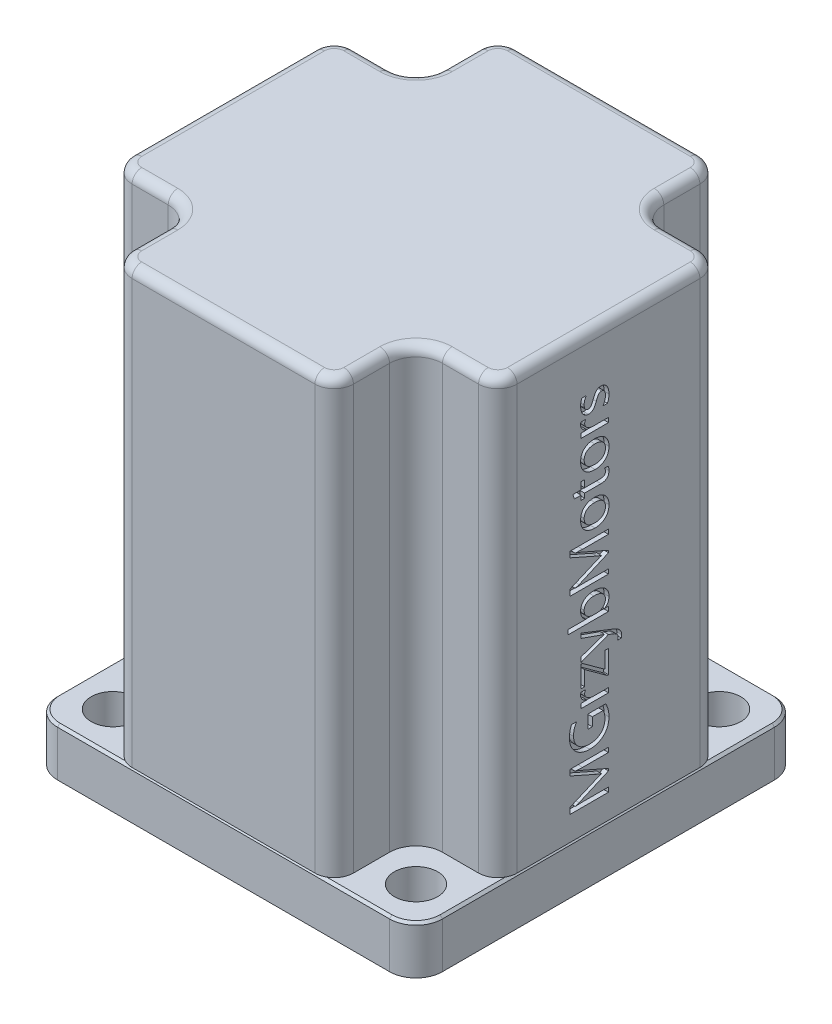
from build123d import *

# Parameters (mm, degrees)
SKETCH1_W                                  = 40
SKETCH1_H                                  = 40
BOSS_EXTRUDE1_DEPTH                        = 5
BOSS_EXTRUDE3_DEPTH                        = 45
SKETCH3_4_R                                = 2.25
CUT_EXTRUDE1_DEPTH                         = 5
MIRROR4_AT_THE_SECOND_PLANE_COPY_1_SKETC_R = 2.25
MIRROR4_AT_THE_SECOND_PLANE_COPY_1_DEPTH   = 5
FILLET3_R                                  = 2.75
FILLET1_R                                  = 2.75
FILLET2_R                                  = 2
MIRROR1_START                              = 5
MIRROR1_DEPTH                              = 45
MIRROR1_2_DEPTH                            = 45
MIRROR1_3_DEPTH                            = 45
FILLET4_R                                  = 1
SKETCH4_R                                  = 5
BOSS_EXTRUDE4_DEPTH                        = 15
CHAMFER1_SIZE                              = 0.75
CHAMFER2_SIZE                              = 0.25
CUT_EXTRUDE3_DEPTH                         = 0.5


# Read off the part's stored shape, not the designer's step: Mirror1
with BuildPart() as part:
    # Sketch1 → Boss-Extrude1 (new body)
    with BuildSketch(Plane(origin=(0, 0, 0), x_dir=(-1, 0, 0), z_dir=(0, 1, 0))):
        Rectangle(SKETCH1_W, SKETCH1_H)
    extrude(amount=BOSS_EXTRUDE1_DEPTH)

    # Sketch3<4> → Cut-Extrude1 (cut)
    with BuildSketch(Plane(origin=(0, 5, 0), x_dir=(-1, 0, 0), z_dir=(0, 1, 0))):
        with Locations(Location((-15.75, 15.75, 0), (0, 0, 90))):
            Circle(SKETCH3_4_R)
    cut_extrude1 = extrude(amount=-CUT_EXTRUDE1_DEPTH, mode=Mode.SUBTRACT)

    # Mirror4: Cut-Extrude1 across plane
    add(cut_extrude1.mirror(Plane.XY), mode=Mode.SUBTRACT)

    # Mirror4 at the second plane: Cut-Extrude1 across plane
    add(cut_extrude1.mirror(Plane(origin=(0, 0, 0), x_dir=(0, 0, 1), z_dir=(1, 0, 0))), mode=Mode.SUBTRACT)

    # Mirror4 at the second plane copy 1 sketc → Mirror4 at the second plane copy 1 (cut)
    with BuildSketch(Plane(origin=(0, 5, 0), x_dir=(1, 0, 0), z_dir=(0, 1, 0))):
        with Locations(Location((-15.75, 15.75, 0), (0, 0, 90))):
            Circle(MIRROR4_AT_THE_SECOND_PLANE_COPY_1_SKETC_R)
    extrude(amount=-MIRROR4_AT_THE_SECOND_PLANE_COPY_1_DEPTH, mode=Mode.SUBTRACT)

    # Fillet3
    fillet3_edges = [part.edges().sort_by_distance(p)[0] for p in [
        (20, 2.5, 20),
        (20, 2.5, -20),
        (-20, 2.5, -20),
        (-20, 2.5, 20),
    ]]
    fillet(fillet3_edges, radius=FILLET3_R)

    # Chamfer2
    chamfer2_edges = [part.edges().sort_by_distance(p)[0] for p in [
        (0, 5, -20),
        (20, 5, 0),
        (-20, 5, 0),
        (0, 5, 20),
        (19.194543648, 5, 19.194543648),
        (-19.194543648, 5, 19.194543648),
        (-19.194543648, 5, -19.194543648),
        (19.194543648, 5, -19.194543648),
    ]]
    chamfer(chamfer2_edges, length=CHAMFER2_SIZE)


with BuildPart() as body_2:
    # Sketch3 → Boss-Extrude3 (new body)
    with BuildSketch(Plane(origin=(0, 5, 0), x_dir=(-1, 0, 0), z_dir=(0, 1, 0))):
        Polygon((-11.5, 20), (-11.5, 11.5), (-20, 11.5), (-20, 0), (0, 0), (0, 20), align=None)
    extrude(amount=BOSS_EXTRUDE3_DEPTH)

    # Fillet1
    fillet1_edges = [body_2.edges().sort_by_distance(p)[0] for p in [
        (11.5, 27.5, 11.5),
    ]]
    fillet(fillet1_edges, radius=FILLET1_R)

    # Fillet2
    fillet2_edges = [body_2.edges().sort_by_distance(p)[0] for p in [
        (20, 27.5, 11.5),
        (11.5, 27.5, 20),
    ]]
    fillet(fillet2_edges, radius=FILLET2_R)


with BuildPart() as body_3:
    # Mirror1 outline → Mirror1 (new body)
    with BuildSketch(Plane(origin=(0, 0, 0), x_dir=(1, 0, 0), z_dir=(0, 1, 0)).offset(MIRROR1_START)):
        with BuildLine():
            ThreePointArc((-18, 11.5), (-19.414213562, 10.914213562), (-20, 9.5))
            Line((-20, 9.5), (-20, 0))
            Line((-20, 0), (0, 0))
            Line((0, 0), (0, 20))
            Line((0, 20), (-9.5, 20))
            ThreePointArc((-9.5, 20), (-10.914213562, 19.414213562), (-11.5, 18))
            Line((-11.5, 18), (-11.5, 14.25))
            ThreePointArc((-11.5, 14.25), (-12.305456352, 12.305456352), (-14.25, 11.5))
            Line((-14.25, 11.5), (-18, 11.5))
        make_face()
    extrude(amount=MIRROR1_DEPTH)


with BuildPart() as body_4:
    # Mirror1 2 outline → Mirror1 2 (new body)
    with BuildSketch(Plane(origin=(0, 0, 0), x_dir=(1, 0, 0), z_dir=(0, 1, 0)).offset(MIRROR1_START)):
        with BuildLine():
            Line((0, 0), (-20, 0))
            Line((-20, 0), (-20, -9.5))
            ThreePointArc((-20, -9.5), (-19.414213562, -10.914213562), (-18, -11.5))
            Line((-18, -11.5), (-14.25, -11.5))
            ThreePointArc((-14.25, -11.5), (-12.305456352, -12.305456352), (-11.5, -14.25))
            Line((-11.5, -14.25), (-11.5, -18))
            ThreePointArc((-11.5, -18), (-10.914213562, -19.414213562), (-9.5, -20))
            Line((-9.5, -20), (0, -20))
            Line((0, -20), (0, 0))
        make_face()
    extrude(amount=MIRROR1_2_DEPTH)


with BuildPart() as body_5:
    # Mirror1 3 outline → Mirror1 3 (new body)
    with BuildSketch(Plane(origin=(0, 0, 0), x_dir=(1, 0, 0), z_dir=(0, 1, 0)).offset(MIRROR1_START)):
        with BuildLine():
            Line((0, 0), (20, 0))
            Line((20, 0), (20, 9.5))
            ThreePointArc((20, 9.5), (19.414213562, 10.914213562), (18, 11.5))
            Line((18, 11.5), (14.25, 11.5))
            ThreePointArc((14.25, 11.5), (12.305456352, 12.305456352), (11.5, 14.25))
            Line((11.5, 14.25), (11.5, 18))
            ThreePointArc((11.5, 18), (10.914213562, 19.414213562), (9.5, 20))
            Line((9.5, 20), (0, 20))
            Line((0, 20), (0, 0))
        make_face()
    extrude(amount=MIRROR1_3_DEPTH)


with BuildPart() as body_2_1:
    add(body_2.part)

    # Combine1: union body 5, body 4, body 3
    add(body_5.part)
    add(body_4.part)
    add(body_3.part)

    # Fillet4
    fillet4_edges = [body_2_1.edges().sort_by_distance(p)[0] for p in [
        (16.125, 50, 11.5),
        (20, 50, 0),
        (12.305456352, 50, 12.305456352),
        (0, 50, 20),
        (11.5, 50, 16.125),
        (10.914213562, 50, 19.414213562),
        (19.414213562, 50, 10.914213562),
        (0, 50, -20),
        (-10.914213562, 50, -19.414213562),
        (-11.5, 50, -16.125),
        (-12.305456352, 50, -12.305456352),
        (-16.125, 50, -11.5),
        (-19.414213562, 50, -10.914213562),
        (-20, 50, 0),
        (16.125, 50, -11.5),
        (11.5, 50, -16.125),
        (12.305456352, 50, -12.305456352),
        (19.414213562, 50, -10.914213562),
        (10.914213562, 50, -19.414213562),
        (-16.125, 50, 11.5),
        (-11.5, 50, 16.125),
        (-12.305456352, 50, 12.305456352),
        (-19.414213562, 50, 10.914213562),
        (-10.914213562, 50, 19.414213562),
    ]]
    fillet(fillet4_edges, radius=FILLET4_R)

    # Sketch7 → Cut-Extrude3 (cut)
    # profile 1 of 12: a face of its own
    with BuildSketch(Plane.YZ.offset(20)):
        with BuildLine():
            Line((11.578947368, 0), (11.105263158, 0))
            Line((11.105263158, 0), (11.105263158, 2.683388158))
            add(Edge.make_bspline(
                [(11.105263158, 2.683388158), (11.105789439, 2.739316175), (11.106899155, 2.857246069), (11.114868306, 3.042863813), (11.127145573, 3.246300748), (11.138706481, 3.387629341), (11.144736842, 3.461348684)],
                knots=[0, 0, 0, 0, 0.861329844, 1.816201289, 2.860894294, 4, 4, 4, 4], degree=3))
            Line((11.144736842, 3.461348684), (11.134046053, 3.461348684))
            add(Edge.make_bspline(
                [(11.134046053, 3.461348684), (11.123633642, 3.419332442), (11.104371156, 3.341604303), (11.073796767, 3.235241686), (11.045939322, 3.147612473), (11.024953149, 3.096660717), (11.015625, 3.074013158)],
                knots=[0, 0, 0, 0, 1.280964309, 2.369725788, 3.275358994, 4, 4, 4, 4], degree=3))
            Line((11.015625, 3.074013158), (9.671875, 0))
            Line((9.671875, 0), (9.447368421, 0))
            Line((9.447368421, 0), (8.106085526, 3.050986842))
            add(Edge.make_bspline(
                [(8.106085526, 3.050986842), (8.096198201, 3.076101014), (8.074302456, 3.131717016), (8.045368844, 3.225772071), (8.016149819, 3.337579809), (7.997582135, 3.418256426), (7.987664474, 3.461348684)],
                knots=[0, 0, 0, 0, 0.757222991, 1.676890445, 2.759144333, 4, 4, 4, 4], degree=3))
            Line((7.987664474, 3.461348684), (7.976973684, 3.461348684))
            add(Edge.make_bspline(
                [(7.976973684, 3.461348684), (7.979066365, 3.439705574), (7.98353747, 3.393464111), (7.986888214, 3.319077655), (7.991390672, 3.235503488), (7.994475171, 3.142283564), (7.997014782, 3.039484478), (7.998257116, 2.927082372), (8.000488668, 2.80537998), (8.00016673, 2.721218289), (8, 2.677631579)],
                knots=[0, 0, 0, 0, 0.665274613, 1.421388671, 2.278025934, 3.226501166, 4.275344644, 5.424668624, 6.666255159, 8, 8, 8, 8], degree=3))
            Line((8, 2.677631579), (8, 0))
            Line((8, 0), (7.526315789, 0))
            Line((7.526315789, 0), (7.526315789, 4))
            Line((7.526315789, 4), (8.166940789, 4))
            Line((8.166940789, 4), (9.370888158, 1.210526316))
            add(Edge.make_bspline(
                [(9.370888158, 1.210526316), (9.392647549, 1.160514265), (9.432972318, 1.067831321), (9.483377708, 0.937427688), (9.524626296, 0.82844843), (9.54343154, 0.761092402), (9.551809211, 0.731085526)],
                knots=[0, 0, 0, 0, 1.275894141, 2.364502614, 3.271391623, 4, 4, 4, 4], degree=3))
            Line((9.551809211, 0.731085526), (9.568256579, 0.731085526))
            add(Edge.make_bspline(
                [(9.568256579, 0.731085526), (9.586766258, 0.782394977), (9.621378569, 0.878341459), (9.671602543, 1.0115504), (9.715372667, 1.124226995), (9.744355626, 1.191678488), (9.757401316, 1.222039474)],
                knots=[0, 0, 0, 0, 1.243852458, 2.325950982, 3.246484013, 4, 4, 4, 4], degree=3))
            Line((9.757401316, 1.222039474), (10.986019737, 4))
            Line((10.986019737, 4), (11.578947368, 4))
            Line((11.578947368, 4), (11.578947368, 0))
        make_face()
    # profile 2 of 12: a face of its own
    with BuildSketch(Plane.YZ.offset(20)):
        with BuildLine():
            add(Edge.make_bspline(
                [(15.631578947, 0.287828947), (15.580966796, 0.260480149), (15.479791398, 0.205808979), (15.321595006, 0.137580356), (15.159759694, 0.078399616), (14.993547356, 0.031406281), (14.823543277, -0.007419389), (14.648882288, -0.032697885), (14.470209469, -0.050348524), (14.34955108, -0.051865777), (14.288651316, -0.052631579)],
                knots=[0, 0, 0, 0, 0.985173486, 1.969395032, 2.948415053, 3.935411455, 4.926689083, 5.933596423, 6.95702659, 8, 8, 8, 8], degree=3))
            add(Edge.make_bspline(
                [(14.288651316, -0.052631579), (14.218655758, -0.051290779), (14.081706281, -0.048667442), (13.88167326, -0.021126974), (13.691496409, 0.021037128), (13.511368371, 0.081103677), (13.342013524, 0.158915654), (13.182482872, 0.253108468), (13.034304567, 0.365959085), (12.896381014, 0.493618189), (12.772267528, 0.63581838), (12.663855552, 0.790442805), (12.572461029, 0.95657201), (12.497072938, 1.133325977), (12.439876865, 1.321539075), (12.397812548, 1.520110119), (12.372916633, 1.730177392), (12.369943077, 1.873836203), (12.368421053, 1.947368421)],
                knots=[0, 0, 0, 0, 1.075463732, 2.104193497, 3.09793841, 4.066788811, 5.017206145, 5.958224378, 6.908968671, 7.875129841, 8.842852226, 9.805053137, 10.772702109, 11.752706894, 12.753796791, 13.791927036, 14.869790854, 16, 16, 16, 16], degree=3))
            add(Edge.make_bspline(
                [(12.368421053, 1.947368421), (12.370110326, 2.022558781), (12.373426342, 2.170156229), (12.400912013, 2.386358595), (12.446873802, 2.59206794), (12.511324705, 2.787388735), (12.593646288, 2.972467392), (12.694850681, 3.146986533), (12.813629504, 3.311666716), (12.950877696, 3.463542528), (13.100965307, 3.601793417), (13.262255237, 3.723249218), (13.434229115, 3.824399883), (13.61542312, 3.90807115), (13.806329806, 3.973478644), (14.007330843, 4.018932596), (14.217902513, 4.047942103), (14.361744677, 4.051048736), (14.435032895, 4.052631579)],
                knots=[0, 0, 0, 0, 1.091168556, 2.141946043, 3.157505749, 4.146549577, 5.122669649, 6.092516332, 7.069941329, 8.064612366, 9.058742024, 10.028066134, 10.989616371, 11.949262799, 12.920716264, 13.912996644, 14.93666257, 16, 16, 16, 16], degree=3))
            add(Edge.make_bspline(
                [(14.435032895, 4.052631579), (14.488225362, 4.052004168), (14.592238403, 4.050777322), (14.745171409, 4.041048431), (14.891320799, 4.023338797), (15.031565795, 4.001131769), (15.164775524, 3.970125065), (15.291958001, 3.934473349), (15.412390488, 3.89106722), (15.488709694, 3.85606369), (15.526315789, 3.838815789)],
                knots=[0, 0, 0, 0, 1.138495796, 2.226225164, 3.277845496, 4.2887232, 5.263699823, 6.203418853, 7.1147392, 8, 8, 8, 8], degree=3))
            Line((15.526315789, 3.838815789), (15.526315789, 3.315789474))
            add(Edge.make_bspline(
                [(15.526315789, 3.315789474), (15.485318772, 3.341159398), (15.403227339, 3.39195952), (15.272530679, 3.455756637), (15.136716688, 3.510084861), (14.995195257, 3.554817191), (14.848060197, 3.589094466), (14.695562235, 3.613624362), (14.537592755, 3.628892809), (14.430407883, 3.630672575), (14.375822368, 3.631578947)],
                knots=[0, 0, 0, 0, 0.955856486, 1.91398384, 2.880300269, 3.855389111, 4.85515173, 5.874246543, 6.917427944, 8, 8, 8, 8], degree=3))
            add(Edge.make_bspline(
                [(14.375822368, 3.631578947), (14.320929068, 3.630138137), (14.213182677, 3.627310065), (14.055269328, 3.605620246), (13.905102488, 3.569532319), (13.762624647, 3.519032756), (13.627568037, 3.454684406), (13.500229399, 3.375113315), (13.38067198, 3.280973935), (13.270095348, 3.173091278), (13.169208118, 3.054855517), (13.081751472, 2.926418397), (13.006927616, 2.790091866), (12.947165671, 2.644515591), (12.900107577, 2.490882338), (12.866673003, 2.32873681), (12.845464083, 2.15818408), (12.843239924, 2.041456706), (12.842105263, 1.981907895)],
                knots=[0, 0, 0, 0, 1.041948336, 2.045170763, 3.01967306, 3.96947189, 4.909927833, 5.854393042, 6.8143471, 7.793369543, 8.782959064, 9.760250794, 10.738429031, 11.730082949, 12.742550622, 13.784706906, 14.869861746, 16, 16, 16, 16], degree=3))
            add(Edge.make_bspline(
                [(12.842105263, 1.981907895), (12.843344193, 1.920723795), (12.845756049, 1.8016151), (12.865168386, 1.628136407), (12.895667113, 1.464467209), (12.940689287, 1.311168261), (12.995905666, 1.166628836), (13.066487711, 1.033467584), (13.148145881, 0.909445795), (13.243012114, 0.797102081), (13.347890699, 0.695680273), (13.463206379, 0.608016109), (13.586935477, 0.533625449), (13.719968135, 0.473125546), (13.861794428, 0.426486628), (14.012709225, 0.392854922), (14.172375442, 0.371787077), (14.282005607, 0.369558951), (14.337993421, 0.368421053)],
                knots=[0, 0, 0, 0, 1.179150513, 2.295483288, 3.360863653, 4.384322083, 5.371505408, 6.338238235, 7.283546942, 8.228737486, 9.166796092, 10.090516322, 11.014886255, 11.944212146, 12.90171567, 13.887554493, 14.92118009, 16, 16, 16, 16], degree=3))
            add(Edge.make_bspline(
                [(14.337993421, 0.368421053), (14.376930487, 0.369177826), (14.453245238, 0.370661064), (14.565877393, 0.378642266), (14.674326665, 0.393499563), (14.778828152, 0.414270492), (14.879880111, 0.439394756), (14.976529104, 0.471519778), (15.069471146, 0.50935006), (15.128483339, 0.539332973), (15.157894737, 0.554276316)],
                knots=[0, 0, 0, 0, 1.10055124, 2.157026801, 3.189133023, 4.191920593, 5.167125343, 6.129942106, 7.067971983, 8, 8, 8, 8], degree=3))
            Line((15.157894737, 0.554276316), (15.157894737, 1.684210526))
            Line((15.157894737, 1.684210526), (14.263157895, 1.684210526))
            Line((14.263157895, 1.684210526), (14.263157895, 2.105263158))
            Line((14.263157895, 2.105263158), (15.631578947, 2.105263158))
            Line((15.631578947, 2.105263158), (15.631578947, 0.287828947))
        make_face()
    # profile 3 of 12: a face of its own
    with BuildSketch(Plane.YZ.offset(20)):
        with BuildLine():
            add(Edge.make_bspline(
                [(17.947368421, 2.368421053), (17.926632713, 2.384831984), (17.883836246, 2.418702537), (17.803783798, 2.450572979), (17.71208595, 2.470564381), (17.646507471, 2.472605341), (17.611842105, 2.473684211)],
                knots=[0, 0, 0, 0, 0.878870937, 1.813903376, 2.84440993, 4, 4, 4, 4], degree=3))
            add(Edge.make_bspline(
                [(17.611842105, 2.473684211), (17.588747005, 2.472989112), (17.54299142, 2.471611997), (17.475879689, 2.45767846), (17.41144772, 2.43641535), (17.349828402, 2.406592274), (17.291786172, 2.367167185), (17.236682073, 2.319314637), (17.184842522, 2.262652748), (17.135521885, 2.198948604), (17.091240961, 2.127262247), (17.052617207, 2.048727235), (17.019624248, 1.964042945), (16.993773306, 1.872726325), (16.972086156, 1.775915403), (16.957454615, 1.672532628), (16.949577247, 1.562898463), (16.948118308, 1.487676741), (16.947368421, 1.449013158)],
                knots=[0, 0, 0, 0, 0.815860524, 1.616367774, 2.413521298, 3.211382041, 4.028854029, 4.888038505, 5.786792903, 6.740897554, 7.733677144, 8.761304915, 9.832598907, 10.943311596, 12.114819035, 13.339252953, 14.632389512, 16, 16, 16, 16], degree=3))
            Line((16.947368421, 1.449013158), (16.947368421, 0))
            Line((16.947368421, 0), (16.473684211, 0))
            Line((16.473684211, 0), (16.473684211, 2.842105263))
            Line((16.473684211, 2.842105263), (16.947368421, 2.842105263))
            Line((16.947368421, 2.842105263), (16.947368421, 2.257401316))
            Line((16.947368421, 2.257401316), (16.958059211, 2.257401316))
            add(Edge.make_bspline(
                [(16.958059211, 2.257401316), (16.974698359, 2.305301063), (17.006882267, 2.3979501), (17.073033601, 2.525112864), (17.152699968, 2.634797348), (17.243381922, 2.727669924), (17.343375571, 2.802152831), (17.451033179, 2.85584091), (17.564990491, 2.888560775), (17.643156228, 2.892666712), (17.682565789, 2.894736842)],
                knots=[0, 0, 0, 0, 1.175184694, 2.273075233, 3.310967915, 4.30922164, 5.273268503, 6.188979233, 7.086920469, 8, 8, 8, 8], degree=3))
            add(Edge.make_bspline(
                [(17.682565789, 2.894736842), (17.709721189, 2.894300901), (17.760856766, 2.893479992), (17.832491966, 2.886546399), (17.894089887, 2.873833505), (17.930489886, 2.860584364), (17.947368421, 2.854440789)],
                knots=[0, 0, 0, 0, 1.209052282, 2.276732743, 3.200927857, 4, 4, 4, 4], degree=3))
            Line((17.947368421, 2.854440789), (17.947368421, 2.368421053))
        make_face()
    # profile 4 of 12: a face of its own
    with BuildSketch(Plane.YZ.offset(20)):
        Polygon((20.473684211, 2.71875), (18.778782895, 0.368421053), (20.473684211, 0.368421053), (20.473684211, 0), (18.105263158, 0), (18.105263158, 0.134046053), (19.800164474, 2.473684211), (18.263157895, 2.473684211), (18.263157895, 2.842105263), (20.473684211, 2.842105263), align=None)
    # profile 5 of 12: a face of its own
    with BuildSketch(Plane.YZ.offset(20)):
        with BuildLine():
            Line((23.263157895, 2.842105263), (21.981085526, -0.460526316))
            add(Edge.make_bspline(
                [(21.981085526, -0.460526316), (21.966916605, -0.49740712), (21.939279818, -0.569343928), (21.892892921, -0.67199935), (21.845309057, -0.76798165), (21.795244072, -0.856586852), (21.743314538, -0.938545404), (21.68928232, -1.013543652), (21.632482431, -1.081005251), (21.573760688, -1.141569208), (21.513014821, -1.19532714), (21.449590374, -1.241447781), (21.384030681, -1.2804483), (21.316700374, -1.312722068), (21.246888244, -1.33746395), (21.175111706, -1.355750635), (21.100943465, -1.366713358), (21.05074883, -1.367849436), (21.025493421, -1.368421053)],
                knots=[0, 0, 0, 0, 1.346777045, 2.626917816, 3.839029768, 4.998283461, 6.095005847, 7.145640523, 8.147242649, 9.098984388, 10.01951448, 10.909358, 11.768486433, 12.6171295, 13.450766775, 14.28947053, 15.139347838, 16, 16, 16, 16], degree=3))
            add(Edge.make_bspline(
                [(21.025493421, -1.368421053), (20.997790438, -1.367937084), (20.944768995, -1.367010804), (20.868975694, -1.360347858), (20.800125455, -1.350208952), (20.757327271, -1.339166839), (20.736842105, -1.333881579)],
                knots=[0, 0, 0, 0, 1.140028558, 2.18192956, 3.129788448, 4, 4, 4, 4], degree=3))
            Line((20.736842105, -1.333881579), (20.736842105, -0.947368421))
            add(Edge.make_bspline(
                [(20.736842105, -0.947368421), (20.760021518, -0.955450135), (20.805062193, -0.971153977), (20.872272468, -0.987230962), (20.936331431, -0.998003761), (20.978030014, -0.999345831), (20.998355263, -1)],
                knots=[0, 0, 0, 0, 1.098295191, 2.134133314, 3.090515715, 4, 4, 4, 4], degree=3))
            add(Edge.make_bspline(
                [(20.998355263, -1), (21.025368939, -0.998873095), (21.078574903, -0.996653551), (21.155357603, -0.974831535), (21.227400103, -0.941140635), (21.29264345, -0.891912317), (21.353913188, -0.830959333), (21.408440733, -0.755324371), (21.458019178, -0.666580863), (21.485049466, -0.601467567), (21.499177632, -0.567434211)],
                knots=[0, 0, 0, 0, 0.914459721, 1.801113994, 2.68718276, 3.598658145, 4.558797161, 5.609770523, 6.750677093, 8, 8, 8, 8], degree=3))
            Line((21.499177632, -0.567434211), (21.720394737, 0))
            Line((21.720394737, 0), (20.631578947, 2.842105263))
            Line((20.631578947, 2.842105263), (21.137335526, 2.842105263))
            Line((21.137335526, 2.842105263), (21.882401316, 0.649671053))
            add(Edge.make_bspline(
                [(21.882401316, 0.649671053), (21.885140617, 0.639802288), (21.892059558, 0.614875715), (21.904860998, 0.56901311), (21.919668318, 0.506231719), (21.931663714, 0.458861204), (21.938322368, 0.432565789)],
                knots=[0, 0, 0, 0, 0.548175527, 1.384584366, 2.548180464, 4, 4, 4, 4], degree=3))
            Line((21.938322368, 0.432565789), (21.954769737, 0.432565789))
            add(Edge.make_bspline(
                [(21.954769737, 0.432565789), (21.957478452, 0.445182193), (21.963676364, 0.474050248), (21.974902435, 0.522180267), (21.991208817, 0.579702427), (22.002262617, 0.621418127), (22.008223684, 0.643914474)],
                knots=[0, 0, 0, 0, 0.710167537, 1.62496037, 2.719194077, 4, 4, 4, 4], degree=3))
            Line((22.008223684, 0.643914474), (22.791118421, 2.842105263))
            Line((22.791118421, 2.842105263), (23.263157895, 2.842105263))
        make_face()
    # profile 6 of 12: a face of its own
    with BuildSketch(Plane.YZ.offset(20)):
        with BuildLine():
            Line((24.273848684, 0.410361842), (24.263157895, 0.410361842))
            Line((24.263157895, 0.410361842), (24.263157895, 0))
            Line((24.263157895, 0), (23.789473684, 0))
            Line((23.789473684, 0), (23.789473684, 4.210526316))
            Line((23.789473684, 4.210526316), (24.263157895, 4.210526316))
            Line((24.263157895, 4.210526316), (24.263157895, 2.34375))
            Line((24.263157895, 2.34375), (24.273848684, 2.34375))
            add(Edge.make_bspline(
                [(24.273848684, 2.34375), (24.302388549, 2.387566834), (24.358092331, 2.47308803), (24.457922895, 2.585761484), (24.567327851, 2.681063705), (24.685621737, 2.760493134), (24.814718637, 2.82093915), (24.953451076, 2.863340486), (25.101443718, 2.890761989), (25.203548338, 2.893392041), (25.255756579, 2.894736842)],
                knots=[0, 0, 0, 0, 1.06086026, 2.070574921, 3.045194812, 4.000949981, 4.954757542, 5.928486642, 6.940791637, 8, 8, 8, 8], degree=3))
            add(Edge.make_bspline(
                [(25.255756579, 2.894736842), (25.300233814, 2.89378259), (25.386838315, 2.891924504), (25.512997417, 2.873063119), (25.631828895, 2.843716845), (25.743720869, 2.802901398), (25.847338032, 2.748438098), (25.944086107, 2.683632595), (26.032871987, 2.605896439), (26.114058083, 2.51742663), (26.185850713, 2.418387704), (26.250081535, 2.312154259), (26.302298598, 2.196702753), (26.346275122, 2.073869537), (26.379463383, 1.942414005), (26.404495711, 1.803170144), (26.41806467, 1.655698277), (26.420041794, 1.554849912), (26.421052632, 1.503289474)],
                knots=[0, 0, 0, 0, 1.040920675, 2.02684396, 2.979693932, 3.903848967, 4.808284923, 5.714541588, 6.624609883, 7.565119002, 8.520387817, 9.484801456, 10.46714454, 11.482351088, 12.536431192, 13.638278224, 14.792529641, 16, 16, 16, 16], degree=3))
            add(Edge.make_bspline(
                [(26.421052632, 1.503289474), (26.419835878, 1.445967268), (26.417455971, 1.333848065), (26.402146819, 1.169921377), (26.374911782, 1.014900414), (26.337437229, 0.868310003), (26.287703831, 0.730987207), (26.228880686, 0.601550467), (26.157363518, 0.481827209), (26.076559055, 0.371027411), (25.986126882, 0.271196409), (25.887220864, 0.184287058), (25.779649749, 0.111130888), (25.66445998, 0.050744601), (25.540694409, 0.005003089), (25.409729704, -0.029334296), (25.270332144, -0.048957435), (25.174676294, -0.051389474), (25.125822368, -0.052631579)],
                knots=[0, 0, 0, 0, 1.205136271, 2.357182818, 3.457185859, 4.511116471, 5.533763717, 6.523921933, 7.495474036, 8.460251117, 9.402651037, 10.321569335, 11.221497407, 12.131408265, 13.048734923, 13.989441718, 14.973155681, 16, 16, 16, 16], degree=3))
            add(Edge.make_bspline(
                [(25.125822368, -0.052631579), (25.080232295, -0.051210928), (24.991271261, -0.048438777), (24.862191534, -0.026834385), (24.74169124, 0.009129507), (24.63035124, 0.061182279), (24.52654467, 0.126092821), (24.432490372, 0.206985628), (24.346410451, 0.301535315), (24.298433434, 0.37349018), (24.273848684, 0.410361842)],
                knots=[0, 0, 0, 0, 1.075804616, 2.099244091, 3.079824819, 4.035292939, 4.992206317, 5.960841921, 6.955079002, 8, 8, 8, 8], degree=3))
        make_face()
        with BuildLine():
            Line((24.263157895, 1.556743421), (24.263157895, 1.160361842))
            add(Edge.make_bspline(
                [(24.263157895, 1.160361842), (24.263713189, 1.131546296), (24.26480664, 1.074804538), (24.275747497, 0.991348805), (24.294006303, 0.911351895), (24.318536207, 0.834357053), (24.350788547, 0.760773579), (24.390591961, 0.690794952), (24.436819462, 0.6236993), (24.489872618, 0.560786678), (24.548778862, 0.503792441), (24.611300631, 0.452863387), (24.678453538, 0.411018982), (24.748874056, 0.376073557), (24.823227885, 0.348623154), (24.901957376, 0.330059345), (24.984292083, 0.318228446), (25.040529217, 0.316610733), (25.069078947, 0.315789474)],
                knots=[0, 0, 0, 0, 1.060559599, 2.088387144, 3.092297372, 4.078599161, 5.059359448, 6.04462781, 7.038543559, 8.055610302, 9.069165237, 10.052777859, 11.018886615, 11.975830704, 12.943361951, 13.929921928, 14.949089947, 16, 16, 16, 16], degree=3))
            add(Edge.make_bspline(
                [(25.069078947, 0.315789474), (25.102578545, 0.316688861), (25.168001519, 0.318445319), (25.26321339, 0.333562697), (25.352903953, 0.358326817), (25.437086326, 0.392697813), (25.515606143, 0.43781435), (25.587828018, 0.493300717), (25.655149324, 0.55789592), (25.715805075, 0.632532827), (25.770986601, 0.715100199), (25.817778145, 0.80675025), (25.858127382, 0.905458581), (25.890849813, 1.012007508), (25.916428816, 1.126112098), (25.933806992, 1.247941852), (25.946113868, 1.37749066), (25.946942221, 1.466525699), (25.947368421, 1.512335526)],
                knots=[0, 0, 0, 0, 0.960642842, 1.876085531, 2.757624475, 3.625159744, 4.477736387, 5.347585705, 6.231961721, 7.148316088, 8.101525753, 9.07588157, 10.095282687, 11.157471837, 12.269835561, 13.44658822, 14.686232383, 16, 16, 16, 16], degree=3))
            add(Edge.make_bspline(
                [(25.947368421, 1.512335526), (25.946889811, 1.551020095), (25.945961154, 1.626080576), (25.934396504, 1.73530884), (25.918759974, 1.8382824), (25.895052885, 1.935000037), (25.863153079, 2.024827561), (25.827044579, 2.109272658), (25.781738496, 2.18622189), (25.731129652, 2.257000844), (25.674302516, 2.320399072), (25.612583882, 2.376048969), (25.545228038, 2.422385339), (25.473207216, 2.460507115), (25.396161374, 2.490171803), (25.314568451, 2.511599845), (25.227909543, 2.524098759), (25.168626872, 2.52556315), (25.138157895, 2.526315789)],
                knots=[0, 0, 0, 0, 1.267625274, 2.459599983, 3.597217075, 4.680470065, 5.717832933, 6.719711725, 7.686140624, 8.638893449, 9.568043686, 10.471815024, 11.35675902, 12.24115529, 13.13734403, 14.057190956, 15.00147205, 16, 16, 16, 16], degree=3))
            add(Edge.make_bspline(
                [(25.138157895, 2.526315789), (25.106030618, 2.525655118), (25.04313668, 2.524361756), (24.951232341, 2.510404438), (24.863819712, 2.48981625), (24.78169926, 2.458511585), (24.703880801, 2.420414868), (24.631981764, 2.371624838), (24.56397515, 2.315696171), (24.501928903, 2.250852979), (24.446554457, 2.179241016), (24.396691062, 2.10380957), (24.355396179, 2.023180859), (24.32170649, 1.938315445), (24.295424388, 1.849114348), (24.276220391, 1.755633402), (24.26588871, 1.657578821), (24.264079035, 1.590756541), (24.263157895, 1.556743421)],
                knots=[0, 0, 0, 0, 1.051521044, 2.058509349, 3.038514229, 3.987506079, 4.931173053, 5.870043286, 6.8265666, 7.810881199, 8.802377694, 9.788615304, 10.768496771, 11.76392932, 12.775351518, 13.810801346, 14.885678894, 16, 16, 16, 16], degree=3))
        make_face(mode=Mode.SUBTRACT)
    # profile 7 of 12: a face of its own
    with BuildSketch(Plane.YZ.offset(20)):
        with BuildLine():
            Line((31.210526316, 0), (30.736842105, 0))
            Line((30.736842105, 0), (30.736842105, 2.683388158))
            add(Edge.make_bspline(
                [(30.736842105, 2.683388158), (30.737368386, 2.739316175), (30.738478102, 2.857246069), (30.746447253, 3.042863813), (30.758724521, 3.246300748), (30.770285428, 3.387629341), (30.776315789, 3.461348684)],
                knots=[0, 0, 0, 0, 0.861329844, 1.816201289, 2.860894294, 4, 4, 4, 4], degree=3))
            Line((30.776315789, 3.461348684), (30.765625, 3.461348684))
            add(Edge.make_bspline(
                [(30.765625, 3.461348684), (30.75521259, 3.419332442), (30.735950103, 3.341604303), (30.705375715, 3.235241686), (30.677518269, 3.147612473), (30.656532097, 3.096660717), (30.647203947, 3.074013158)],
                knots=[0, 0, 0, 0, 1.280964309, 2.369725788, 3.275358994, 4, 4, 4, 4], degree=3))
            Line((30.647203947, 3.074013158), (29.303453947, 0))
            Line((29.303453947, 0), (29.078947368, 0))
            Line((29.078947368, 0), (27.737664474, 3.050986842))
            add(Edge.make_bspline(
                [(27.737664474, 3.050986842), (27.727777148, 3.076101014), (27.705881404, 3.131717016), (27.676947791, 3.225772071), (27.647728766, 3.337579809), (27.629161083, 3.418256426), (27.619243421, 3.461348684)],
                knots=[0, 0, 0, 0, 0.757222991, 1.676890445, 2.759144333, 4, 4, 4, 4], degree=3))
            Line((27.619243421, 3.461348684), (27.608552632, 3.461348684))
            add(Edge.make_bspline(
                [(27.608552632, 3.461348684), (27.610645312, 3.439705574), (27.615116418, 3.393464111), (27.618467161, 3.319077655), (27.62296962, 3.235503488), (27.626054118, 3.142283564), (27.628593729, 3.039484478), (27.629836063, 2.927082372), (27.632067616, 2.80537998), (27.631745677, 2.721218289), (27.631578947, 2.677631579)],
                knots=[0, 0, 0, 0, 0.665274613, 1.421388671, 2.278025934, 3.226501166, 4.275344644, 5.424668624, 6.666255159, 8, 8, 8, 8], degree=3))
            Line((27.631578947, 2.677631579), (27.631578947, 0))
            Line((27.631578947, 0), (27.157894737, 0))
            Line((27.157894737, 0), (27.157894737, 4))
            Line((27.157894737, 4), (27.798519737, 4))
            Line((27.798519737, 4), (29.002467105, 1.210526316))
            add(Edge.make_bspline(
                [(29.002467105, 1.210526316), (29.024226496, 1.160514265), (29.064551265, 1.067831321), (29.114956655, 0.937427688), (29.156205243, 0.82844843), (29.175010487, 0.761092402), (29.183388158, 0.731085526)],
                knots=[0, 0, 0, 0, 1.275894141, 2.364502614, 3.271391623, 4, 4, 4, 4], degree=3))
            Line((29.183388158, 0.731085526), (29.199835526, 0.731085526))
            add(Edge.make_bspline(
                [(29.199835526, 0.731085526), (29.218345206, 0.782394977), (29.252957516, 0.878341459), (29.30318149, 1.0115504), (29.346951614, 1.124226995), (29.375934574, 1.191678488), (29.388980263, 1.222039474)],
                knots=[0, 0, 0, 0, 1.243852458, 2.325950982, 3.246484013, 4, 4, 4, 4], degree=3))
            Line((29.388980263, 1.222039474), (30.617598684, 4))
            Line((30.617598684, 4), (31.210526316, 4))
            Line((31.210526316, 4), (31.210526316, 0))
        make_face()
    # profile 8 of 12: a face of its own
    with BuildSketch(Plane.YZ.offset(20)):
        with BuildLine():
            add(Edge.make_bspline(
                [(33.378289474, -0.052631579), (33.32725681, -0.051257709), (33.22733232, -0.048567603), (33.081235004, -0.030765859), (32.943458679, 0.000890012), (32.812972529, 0.043277816), (32.691196157, 0.099779665), (32.576375765, 0.167155225), (32.471041314, 0.248827476), (32.37302839, 0.340612562), (32.285118877, 0.443083512), (32.209565258, 0.555103527), (32.143673755, 0.673806132), (32.091326784, 0.801488662), (32.049737968, 0.93685165), (32.021970726, 1.080536691), (32.002776694, 1.231665905), (32.000939855, 1.335188521), (32, 1.388157895)],
                knots=[0, 0, 0, 0, 1.089313778, 2.132930502, 3.135044108, 4.102745131, 5.055740899, 5.994986292, 6.938232671, 7.89440244, 8.857155549, 9.813038836, 10.774065735, 11.749852285, 12.75304146, 13.791528038, 14.869992074, 16, 16, 16, 16], degree=3))
            add(Edge.make_bspline(
                [(32, 1.388157895), (32.000867631, 1.445786724), (32.002554257, 1.557813875), (32.022474746, 1.72080844), (32.052207108, 1.874516754), (32.095002968, 2.018507696), (32.149246625, 2.153382326), (32.217133922, 2.277701995), (32.296290114, 2.393088463), (32.388027913, 2.497533436), (32.489567072, 2.59128312), (32.601059217, 2.672416303), (32.720410495, 2.741913105), (32.849117078, 2.798014646), (32.986146864, 2.841448666), (33.131489814, 2.872780681), (33.285458923, 2.890751423), (33.390852332, 2.893385835), (33.444901316, 2.894736842)],
                knots=[0, 0, 0, 0, 1.169314379, 2.273080329, 3.328465255, 4.344437856, 5.31792802, 6.274165601, 7.214267678, 8.152935628, 9.090315946, 10.014185087, 10.946745851, 11.888690944, 12.858435829, 13.860458066, 14.902777048, 16, 16, 16, 16], degree=3))
            add(Edge.make_bspline(
                [(33.444901316, 2.894736842), (33.496217286, 2.89374478), (33.596444554, 2.891807145), (33.742387797, 2.87342586), (33.879883448, 2.843166307), (34.008394288, 2.800555221), (34.128326913, 2.74564), (34.239801888, 2.679053526), (34.34252231, 2.599539793), (34.435167377, 2.507918312), (34.518772769, 2.406461185), (34.591403031, 2.29466116), (34.652954649, 2.173599904), (34.703587504, 2.043352261), (34.741820791, 1.903528839), (34.769708648, 1.754485221), (34.786143938, 1.59603656), (34.788345097, 1.487429112), (34.789473684, 1.431743421)],
                knots=[0, 0, 0, 0, 1.092510313, 2.133825467, 3.126750728, 4.086777224, 5.011576573, 5.930719604, 6.846258503, 7.771020995, 8.700195898, 9.641017952, 10.604482175, 11.587835394, 12.611938361, 13.687136717, 14.814138521, 16, 16, 16, 16], degree=3))
            add(Edge.make_bspline(
                [(34.789473684, 1.431743421), (34.788478946, 1.376869953), (34.786538413, 1.26982288), (34.768199021, 1.11347631), (34.73741141, 0.965961047), (34.697094812, 0.825790711), (34.642110074, 0.69471642), (34.576314032, 0.571234777), (34.497893682, 0.456585528), (34.407927733, 0.351420913), (34.308995072, 0.25564311), (34.19992077, 0.17327541), (34.082718563, 0.103832485), (33.957974924, 0.045538023), (33.82429336, 0.001418001), (33.682620964, -0.029574728), (33.53315295, -0.048912527), (33.430706898, -0.051372773), (33.378289474, -0.052631579)],
                knots=[0, 0, 0, 0, 1.139275355, 2.222496528, 3.263066052, 4.26638862, 5.246442572, 6.209214621, 7.167685132, 8.124785227, 9.079036703, 10.021790444, 10.956135899, 11.903638887, 12.875773987, 13.873005349, 14.911704465, 16, 16, 16, 16], degree=3))
        make_face()
        with BuildLine():
            add(Edge.make_bspline(
                [(33.411184211, 2.526315789), (33.376048634, 2.525343539), (33.307137989, 2.523436684), (33.206850222, 2.509254), (33.111877859, 2.486377064), (33.022831394, 2.453297253), (32.939219411, 2.411148671), (32.861118569, 2.359871545), (32.789423538, 2.298457618), (32.723609204, 2.22836901), (32.664259652, 2.150301477), (32.613301419, 2.064353682), (32.570344411, 1.971394699), (32.535236183, 1.871645427), (32.507010798, 1.765017975), (32.487574691, 1.651087629), (32.476126514, 1.53011539), (32.474511498, 1.447119606), (32.473684211, 1.404605263)],
                knots=[0, 0, 0, 0, 1.020548215, 2.0015791, 2.936492877, 3.853735458, 4.754862168, 5.651684838, 6.561323672, 7.490964538, 8.440319683, 9.404623611, 10.388076121, 11.410797369, 12.47327636, 13.588845399, 14.764893261, 16, 16, 16, 16], degree=3))
            add(Edge.make_bspline(
                [(32.473684211, 1.404605263), (32.47452193, 1.363463947), (32.47615054, 1.283481202), (32.487405065, 1.166513018), (32.508066815, 1.056587302), (32.536012785, 0.953144435), (32.571214887, 0.856283019), (32.61497264, 0.766129964), (32.667012334, 0.682559645), (32.726903251, 0.606224475), (32.793511114, 0.538017898), (32.865520418, 0.478171069), (32.943122544, 0.427440564), (33.027001919, 0.38747472), (33.11528097, 0.355066667), (33.20896671, 0.331819122), (33.308301056, 0.31890818), (33.37633434, 0.316845881), (33.411184211, 0.315789474)],
                knots=[0, 0, 0, 0, 1.217419787, 2.366783194, 3.472496404, 4.523288688, 5.53441524, 6.517563136, 7.483153408, 8.442179613, 9.382918504, 10.298957868, 11.207930701, 12.118530802, 13.042330773, 13.98666488, 14.96867437, 16, 16, 16, 16], degree=3))
            add(Edge.make_bspline(
                [(33.411184211, 0.315789474), (33.446602397, 0.316372044), (33.515543403, 0.317506009), (33.615422514, 0.332262846), (33.709255442, 0.354076261), (33.796804368, 0.385353965), (33.878138263, 0.425734603), (33.952467051, 0.475836251), (34.021725429, 0.533468725), (34.083162719, 0.601533411), (34.138118189, 0.677162125), (34.186420059, 0.760228842), (34.226479726, 0.851083913), (34.259319036, 0.94939377), (34.284882075, 1.055324659), (34.302190274, 1.168694068), (34.314557712, 1.289477079), (34.31537049, 1.372498758), (34.315789474, 1.415296053)],
                knots=[0, 0, 0, 0, 1.050075063, 2.043956456, 2.988972905, 3.904907121, 4.796128792, 5.675956403, 6.559124027, 7.463024371, 8.388766097, 9.329080069, 10.308578247, 11.329744704, 12.400997105, 13.537664858, 14.730677514, 16, 16, 16, 16], degree=3))
            add(Edge.make_bspline(
                [(34.315789474, 1.415296053), (34.315364178, 1.4586402), (34.314538853, 1.542753377), (34.30227258, 1.66492106), (34.284757359, 1.779618763), (34.259445038, 1.886696387), (34.226512476, 1.98609609), (34.186160403, 2.077865791), (34.138591176, 2.162189845), (34.083192832, 2.238171666), (34.021188971, 2.30608268), (33.95303842, 2.365559857), (33.878086847, 2.415526694), (33.796646993, 2.455735622), (33.709439662, 2.488272582), (33.615396028, 2.509766965), (33.51555061, 2.524619784), (33.446604843, 2.525740187), (33.411184211, 2.526315789)],
                knots=[0, 0, 0, 0, 1.27768624, 2.47946393, 3.61713162, 4.697522441, 5.720080538, 6.700950438, 7.649507429, 8.569561145, 9.467907677, 10.356158465, 11.230580174, 12.116325936, 13.029392161, 13.968602171, 14.956376886, 16, 16, 16, 16], degree=3))
        make_face(mode=Mode.SUBTRACT)
    # profile 9 of 12: a face of its own
    with BuildSketch(Plane.YZ.offset(20)):
        with BuildLine():
            add(Edge.make_bspline(
                [(36.894736842, 0.035361842), (36.865217838, 0.021501435), (36.803548431, -0.007454931), (36.698770153, -0.032973565), (36.581691346, -0.049639849), (36.498974147, -0.051602331), (36.455592105, -0.052631579)],
                knots=[0, 0, 0, 0, 0.864004118, 1.805027716, 2.848820076, 4, 4, 4, 4], degree=3))
            add(Edge.make_bspline(
                [(36.455592105, -0.052631579), (36.424312063, -0.052053428), (36.363779288, -0.050934596), (36.27604249, -0.040815924), (36.194424926, -0.024858043), (36.118954098, -0.001216382), (36.048575223, 0.026805385), (35.984844445, 0.06333974), (35.92783864, 0.106636359), (35.875842991, 0.15545979), (35.831049811, 0.211855128), (35.790679855, 0.273941909), (35.758423284, 0.34347302), (35.731099893, 0.418837366), (35.709523701, 0.500803269), (35.695418429, 0.58951965), (35.686089291, 0.684561702), (35.684849838, 0.749976208), (35.684210526, 0.783717105)],
                knots=[0, 0, 0, 0, 1.150531805, 2.226495784, 3.245199699, 4.205507608, 5.132668183, 6.027159161, 6.898607221, 7.761844955, 8.64396752, 9.542090504, 10.48048451, 11.456813977, 12.489207029, 13.593539822, 14.758744345, 16, 16, 16, 16], degree=3))
            Line((35.684210526, 0.783717105), (35.684210526, 2.473684211))
            Line((35.684210526, 2.473684211), (35.210526316, 2.473684211))
            Line((35.210526316, 2.473684211), (35.210526316, 2.842105263))
            Line((35.210526316, 2.842105263), (35.684210526, 2.842105263))
            Line((35.684210526, 2.842105263), (35.684210526, 3.537006579))
            Line((35.684210526, 3.537006579), (36.157894737, 3.684210526))
            Line((36.157894737, 3.684210526), (36.157894737, 2.842105263))
            Line((36.157894737, 2.842105263), (36.894736842, 2.842105263))
            Line((36.894736842, 2.842105263), (36.894736842, 2.473684211))
            Line((36.894736842, 2.473684211), (36.157894737, 2.473684211))
            Line((36.157894737, 2.473684211), (36.157894737, 0.852796053))
            add(Edge.make_bspline(
                [(36.157894737, 0.852796053), (36.158153169, 0.829482918), (36.158649387, 0.784719291), (36.164018803, 0.719991476), (36.170880658, 0.660318495), (36.181413024, 0.605812618), (36.195627363, 0.556628019), (36.212351434, 0.512262923), (36.233307831, 0.473366736), (36.263697209, 0.427668462), (36.314740722, 0.380602559), (36.392723646, 0.343327992), (36.485346815, 0.318557148), (36.552717891, 0.31675505), (36.588815789, 0.315789474)],
                knots=[0, 0, 0, 0, 1.051544807, 2.019074677, 2.928751862, 3.760703273, 4.520083606, 5.236663043, 5.89506118, 6.509101843, 7.708002737, 8.969082895, 10.376013215, 12, 12, 12, 12], degree=3))
            add(Edge.make_bspline(
                [(36.588815789, 0.315789474), (36.617451938, 0.316981698), (36.673521142, 0.319316057), (36.754213526, 0.339774603), (36.829282045, 0.372640978), (36.872791726, 0.404821593), (36.894736842, 0.421052632)],
                knots=[0, 0, 0, 0, 1.040197916, 2.03669393, 3.009761086, 4, 4, 4, 4], degree=3))
            Line((36.894736842, 0.421052632), (36.894736842, 0.035361842))
        make_face()
    # profile 10 of 12: a face of its own
    with BuildSketch(Plane.YZ.offset(20)):
        with BuildLine():
            add(Edge.make_bspline(
                [(38.641447368, -0.052631579), (38.590414705, -0.051257709), (38.490490214, -0.048567603), (38.344392899, -0.030765859), (38.206616574, 0.000890012), (38.076130424, 0.043277816), (37.954354052, 0.099779665), (37.83953366, 0.167155225), (37.734199209, 0.248827476), (37.636186285, 0.340612562), (37.548276772, 0.443083512), (37.472723153, 0.555103527), (37.40683165, 0.673806132), (37.354484679, 0.801488662), (37.312895863, 0.93685165), (37.28512862, 1.080536691), (37.265934589, 1.231665905), (37.26409775, 1.335188521), (37.263157895, 1.388157895)],
                knots=[0, 0, 0, 0, 1.089313778, 2.132930502, 3.135044108, 4.102745131, 5.055740899, 5.994986292, 6.938232671, 7.89440244, 8.857155549, 9.813038836, 10.774065735, 11.749852285, 12.75304146, 13.791528038, 14.869992074, 16, 16, 16, 16], degree=3))
            add(Edge.make_bspline(
                [(37.263157895, 1.388157895), (37.264025526, 1.445786724), (37.265712152, 1.557813875), (37.28563264, 1.72080844), (37.315365003, 1.874516754), (37.358160863, 2.018507696), (37.412404519, 2.153382326), (37.480291817, 2.277701995), (37.559448008, 2.393088463), (37.651185808, 2.497533436), (37.752724966, 2.59128312), (37.864217112, 2.672416303), (37.98356839, 2.741913105), (38.112274973, 2.798014646), (38.249304759, 2.841448666), (38.394647709, 2.872780681), (38.548616818, 2.890751423), (38.654010227, 2.893385835), (38.708059211, 2.894736842)],
                knots=[0, 0, 0, 0, 1.169314379, 2.273080329, 3.328465255, 4.344437856, 5.31792802, 6.274165601, 7.214267678, 8.152935628, 9.090315946, 10.014185087, 10.946745851, 11.888690944, 12.858435829, 13.860458066, 14.902777048, 16, 16, 16, 16], degree=3))
            add(Edge.make_bspline(
                [(38.708059211, 2.894736842), (38.759375181, 2.89374478), (38.859602449, 2.891807145), (39.005545692, 2.87342586), (39.143041343, 2.843166307), (39.271552183, 2.800555221), (39.391484808, 2.74564), (39.502959783, 2.679053526), (39.605680204, 2.599539793), (39.698325272, 2.507918312), (39.781930663, 2.406461185), (39.854560925, 2.29466116), (39.916112544, 2.173599904), (39.966745398, 2.043352261), (40.004978686, 1.903528839), (40.032866543, 1.754485221), (40.049301833, 1.59603656), (40.051502991, 1.487429112), (40.052631579, 1.431743421)],
                knots=[0, 0, 0, 0, 1.092510313, 2.133825467, 3.126750728, 4.086777224, 5.011576573, 5.930719604, 6.846258503, 7.771020995, 8.700195898, 9.641017952, 10.604482175, 11.587835394, 12.611938361, 13.687136717, 14.814138521, 16, 16, 16, 16], degree=3))
            add(Edge.make_bspline(
                [(40.052631579, 1.431743421), (40.051636841, 1.376869953), (40.049696307, 1.26982288), (40.031356916, 1.11347631), (40.000569304, 0.965961047), (39.960252707, 0.825790711), (39.905267968, 0.69471642), (39.839471927, 0.571234777), (39.761051577, 0.456585528), (39.671085627, 0.351420913), (39.572152967, 0.25564311), (39.463078665, 0.17327541), (39.345876458, 0.103832485), (39.221132819, 0.045538023), (39.087451255, 0.001418001), (38.945778858, -0.029574728), (38.796310845, -0.048912527), (38.693864793, -0.051372773), (38.641447368, -0.052631579)],
                knots=[0, 0, 0, 0, 1.139275355, 2.222496528, 3.263066052, 4.26638862, 5.246442572, 6.209214621, 7.167685132, 8.124785227, 9.079036703, 10.021790444, 10.956135899, 11.903638887, 12.875773987, 13.873005349, 14.911704465, 16, 16, 16, 16], degree=3))
        make_face()
        with BuildLine():
            add(Edge.make_bspline(
                [(38.674342105, 2.526315789), (38.639206529, 2.525343539), (38.570295884, 2.523436684), (38.470008117, 2.509254), (38.375035754, 2.486377064), (38.285989289, 2.453297253), (38.202377305, 2.411148671), (38.124276464, 2.359871545), (38.052581432, 2.298457618), (37.986767099, 2.22836901), (37.927417547, 2.150301477), (37.876459314, 2.064353682), (37.833502306, 1.971394699), (37.798394078, 1.871645427), (37.770168693, 1.765017975), (37.750732585, 1.651087629), (37.739284409, 1.53011539), (37.737669392, 1.447119606), (37.736842105, 1.404605263)],
                knots=[0, 0, 0, 0, 1.020548215, 2.0015791, 2.936492877, 3.853735458, 4.754862168, 5.651684838, 6.561323672, 7.490964538, 8.440319683, 9.404623611, 10.388076121, 11.410797369, 12.47327636, 13.588845399, 14.764893261, 16, 16, 16, 16], degree=3))
            add(Edge.make_bspline(
                [(37.736842105, 1.404605263), (37.737679825, 1.363463947), (37.739308434, 1.283481202), (37.75056296, 1.166513018), (37.77122471, 1.056587302), (37.799170679, 0.953144435), (37.834372781, 0.856283019), (37.878130534, 0.766129964), (37.930170229, 0.682559645), (37.990061145, 0.606224475), (38.056669008, 0.538017898), (38.128678313, 0.478171069), (38.206280439, 0.427440564), (38.290159814, 0.38747472), (38.378438865, 0.355066667), (38.472124605, 0.331819122), (38.571458951, 0.31890818), (38.639492234, 0.316845881), (38.674342105, 0.315789474)],
                knots=[0, 0, 0, 0, 1.217419787, 2.366783194, 3.472496404, 4.523288688, 5.53441524, 6.517563136, 7.483153408, 8.442179613, 9.382918504, 10.298957868, 11.207930701, 12.118530802, 13.042330773, 13.98666488, 14.96867437, 16, 16, 16, 16], degree=3))
            add(Edge.make_bspline(
                [(38.674342105, 0.315789474), (38.709760292, 0.316372044), (38.778701298, 0.317506009), (38.878580408, 0.332262846), (38.972413337, 0.354076261), (39.059962263, 0.385353965), (39.141296157, 0.425734603), (39.215624946, 0.475836251), (39.284883324, 0.533468725), (39.346320614, 0.601533411), (39.401276084, 0.677162125), (39.449577953, 0.760228842), (39.489637621, 0.851083913), (39.522476931, 0.94939377), (39.54803997, 1.055324659), (39.565348169, 1.168694068), (39.577715607, 1.289477079), (39.578528385, 1.372498758), (39.578947368, 1.415296053)],
                knots=[0, 0, 0, 0, 1.050075063, 2.043956456, 2.988972905, 3.904907121, 4.796128792, 5.675956403, 6.559124027, 7.463024371, 8.388766097, 9.329080069, 10.308578247, 11.329744704, 12.400997105, 13.537664858, 14.730677514, 16, 16, 16, 16], degree=3))
            add(Edge.make_bspline(
                [(39.578947368, 1.415296053), (39.578522073, 1.4586402), (39.577696748, 1.542753377), (39.565430474, 1.66492106), (39.547915254, 1.779618763), (39.522602932, 1.886696387), (39.489670371, 1.98609609), (39.449318298, 2.077865791), (39.401749071, 2.162189845), (39.346350727, 2.238171666), (39.284346866, 2.30608268), (39.216196314, 2.365559857), (39.141244742, 2.415526694), (39.059804888, 2.455735622), (38.972597557, 2.488272582), (38.878553923, 2.509766965), (38.778708505, 2.524619784), (38.709762738, 2.525740187), (38.674342105, 2.526315789)],
                knots=[0, 0, 0, 0, 1.27768624, 2.47946393, 3.61713162, 4.697522441, 5.720080538, 6.700950438, 7.649507429, 8.569561145, 9.467907677, 10.356158465, 11.230580174, 12.116325936, 13.029392161, 13.968602171, 14.956376886, 16, 16, 16, 16], degree=3))
        make_face(mode=Mode.SUBTRACT)
    # profile 11 of 12: a face of its own
    with BuildSketch(Plane.YZ.offset(20)):
        with BuildLine():
            add(Edge.make_bspline(
                [(42.263157895, 2.368421053), (42.242422187, 2.384831984), (42.19962572, 2.418702537), (42.119573271, 2.450572979), (42.027875423, 2.470564381), (41.962296945, 2.472605341), (41.927631579, 2.473684211)],
                knots=[0, 0, 0, 0, 0.878870937, 1.813903376, 2.84440993, 4, 4, 4, 4], degree=3))
            add(Edge.make_bspline(
                [(41.927631579, 2.473684211), (41.904536479, 2.472989112), (41.858780893, 2.471611997), (41.791669163, 2.45767846), (41.727237194, 2.43641535), (41.665617876, 2.406592274), (41.607575645, 2.367167185), (41.552471546, 2.319314637), (41.500631996, 2.262652748), (41.451311358, 2.198948604), (41.407030435, 2.127262247), (41.36840668, 2.048727235), (41.335413722, 1.964042945), (41.30956278, 1.872726325), (41.28787563, 1.775915403), (41.273244088, 1.672532628), (41.265366721, 1.562898463), (41.263907782, 1.487676741), (41.263157895, 1.449013158)],
                knots=[0, 0, 0, 0, 0.815860524, 1.616367774, 2.413521298, 3.211382041, 4.028854029, 4.888038505, 5.786792903, 6.740897554, 7.733677144, 8.761304915, 9.832598907, 10.943311596, 12.114819035, 13.339252953, 14.632389512, 16, 16, 16, 16], degree=3))
            Line((41.263157895, 1.449013158), (41.263157895, 0))
            Line((41.263157895, 0), (40.789473684, 0))
            Line((40.789473684, 0), (40.789473684, 2.842105263))
            Line((40.789473684, 2.842105263), (41.263157895, 2.842105263))
            Line((41.263157895, 2.842105263), (41.263157895, 2.257401316))
            Line((41.263157895, 2.257401316), (41.273848684, 2.257401316))
            add(Edge.make_bspline(
                [(41.273848684, 2.257401316), (41.290487833, 2.305301063), (41.322671741, 2.3979501), (41.388823075, 2.525112864), (41.468489442, 2.634797348), (41.559171396, 2.727669924), (41.659165045, 2.802152831), (41.766822653, 2.85584091), (41.880779965, 2.888560775), (41.958945702, 2.892666712), (41.998355263, 2.894736842)],
                knots=[0, 0, 0, 0, 1.175184694, 2.273075233, 3.310967915, 4.30922164, 5.273268503, 6.188979233, 7.086920469, 8, 8, 8, 8], degree=3))
            add(Edge.make_bspline(
                [(41.998355263, 2.894736842), (42.025510663, 2.894300901), (42.07664624, 2.893479992), (42.14828144, 2.886546399), (42.20987936, 2.873833505), (42.24627936, 2.860584364), (42.263157895, 2.854440789)],
                knots=[0, 0, 0, 0, 1.209052282, 2.276732743, 3.200927857, 4, 4, 4, 4], degree=3))
            Line((42.263157895, 2.854440789), (42.263157895, 2.368421053))
        make_face()
    # profile 12 of 12: a face of its own
    with BuildSketch(Plane.YZ.offset(20)):
        with BuildLine():
            Line((42.578947368, 0.110197368), (42.578947368, 0.578947368))
            add(Edge.make_bspline(
                [(42.578947368, 0.578947368), (42.610180608, 0.557926395), (42.671861768, 0.516412994), (42.768851097, 0.46260064), (42.868247073, 0.417560405), (42.969890457, 0.380206695), (43.073856307, 0.351343037), (43.180276119, 0.330861207), (43.289162251, 0.318103575), (43.36262978, 0.316565134), (43.399671053, 0.315789474)],
                knots=[0, 0, 0, 0, 1.031192281, 2.036456585, 3.034738237, 4.018447315, 5.000635555, 5.98755077, 6.985351984, 8, 8, 8, 8], degree=3))
            add(Edge.make_bspline(
                [(43.399671053, 0.315789474), (43.44661261, 0.316956881), (43.534624696, 0.319145687), (43.657814365, 0.337494435), (43.762718201, 0.368930348), (43.849717865, 0.412902832), (43.917797684, 0.471394408), (43.965924484, 0.543874469), (43.995943963, 0.629340985), (43.998609695, 0.690805294), (44, 0.722861842)],
                knots=[0, 0, 0, 0, 1.369764611, 2.568211402, 3.623599665, 4.554158241, 5.393446019, 6.212346947, 7.067654267, 8, 8, 8, 8], degree=3))
            add(Edge.make_bspline(
                [(44, 0.722861842), (43.999433949, 0.741010999), (43.998335679, 0.77622456), (43.988031584, 0.826473584), (43.97285032, 0.873000986), (43.940697356, 0.928226209), (43.888141638, 0.991598589), (43.807232321, 1.056406038), (43.710901448, 1.114012655), (43.599184258, 1.163176218), (43.476520104, 1.211998146), (43.391215232, 1.244619796), (43.347039474, 1.261513158)],
                knots=[0, 0, 0, 0, 0.600107466, 1.164347246, 1.692467022, 2.212571421, 3.270058008, 4.398428074, 5.62806806, 6.976348644, 8.434179782, 10, 10, 10, 10], degree=3))
            add(Edge.make_bspline(
                [(43.347039474, 1.261513158), (43.287282451, 1.285834576), (43.174254789, 1.331837419), (43.040338562, 1.395931641), (42.944480903, 1.448013419), (42.882155597, 1.490833692), (42.824200189, 1.533726653), (42.77269717, 1.580252514), (42.727227491, 1.629774579), (42.687607239, 1.682265497), (42.654387561, 1.738424637), (42.626047686, 1.797596342), (42.60452598, 1.861651129), (42.590103325, 1.930397641), (42.580855769, 2.003862418), (42.579595793, 2.054521371), (42.578947368, 2.080592105)],
                knots=[0, 0, 0, 0, 2.234623848, 4.226688256, 5.140780195, 6.009963599, 6.843771854, 7.637176755, 8.410142252, 9.169868541, 9.910905988, 10.667062674, 11.438860549, 12.245399105, 13.097025674, 14, 14, 14, 14], degree=3))
            add(Edge.make_bspline(
                [(42.578947368, 2.080592105), (42.579893035, 2.112768106), (42.581743778, 2.175739069), (42.600957796, 2.266817711), (42.629173467, 2.352809482), (42.671151644, 2.431994843), (42.722561219, 2.504975337), (42.780967403, 2.573085558), (42.848056089, 2.634024937), (42.92260409, 2.688196269), (43.003133564, 2.736849319), (43.090095571, 2.778549111), (43.181927222, 2.815117618), (43.279371739, 2.843223032), (43.379822896, 2.866334697), (43.482590737, 2.882577147), (43.586958613, 2.892911923), (43.657047938, 2.894124595), (43.692434211, 2.894736842)],
                knots=[0, 0, 0, 0, 1.00416541, 1.965230619, 2.897216393, 3.824543987, 4.753808744, 5.683073502, 6.623018912, 7.57918382, 8.559193498, 9.559257267, 10.590183954, 11.644657002, 12.725392789, 13.809925162, 14.894288328, 16, 16, 16, 16], degree=3))
            add(Edge.make_bspline(
                [(43.692434211, 2.894736842), (43.75391707, 2.893118207), (43.873764159, 2.889963038), (44.048679173, 2.866504815), (44.213975388, 2.82826553), (44.317540166, 2.788467203), (44.368421053, 2.768914474)],
                knots=[0, 0, 0, 0, 1.065961906, 2.077854444, 3.055658969, 4, 4, 4, 4], degree=3))
            Line((44.368421053, 2.768914474), (44.368421053, 2.315789474))
            add(Edge.make_bspline(
                [(44.368421053, 2.315789474), (44.341250413, 2.332657048), (44.287197353, 2.366213269), (44.201889548, 2.409026125), (44.113873158, 2.445151166), (44.022691638, 2.475131363), (43.928319312, 2.497893971), (43.83078231, 2.514366881), (43.730476773, 2.524459267), (43.662578118, 2.525692839), (43.628289474, 2.526315789)],
                knots=[0, 0, 0, 0, 0.982954277, 1.955481637, 2.930635286, 3.906189551, 4.903814795, 5.912593762, 6.945865274, 8, 8, 8, 8], degree=3))
            add(Edge.make_bspline(
                [(43.628289474, 2.526315789), (43.586500981, 2.525079897), (43.506659714, 2.522718597), (43.394007327, 2.499982684), (43.294631456, 2.465401093), (43.210994816, 2.416594016), (43.141963314, 2.357427728), (43.09087727, 2.286762922), (43.058838038, 2.205636772), (43.054719596, 2.148308433), (43.052631579, 2.119243421)],
                knots=[0, 0, 0, 0, 1.2749384, 2.435902595, 3.495354675, 4.474755453, 5.37664236, 6.252661054, 7.114113052, 8, 8, 8, 8], degree=3))
            add(Edge.make_bspline(
                [(43.052631579, 2.119243421), (43.053103338, 2.101681488), (43.054014548, 2.067760332), (43.061013017, 2.018956869), (43.074683816, 1.975024163), (43.097486476, 1.921253149), (43.142602813, 1.861575534), (43.212268068, 1.797992058), (43.300853386, 1.744028332), (43.40532904, 1.695095945), (43.525500236, 1.647605379), (43.610457988, 1.614541023), (43.655427632, 1.597039474)],
                knots=[0, 0, 0, 0, 0.612929111, 1.183882462, 1.713507987, 2.21472389, 3.215602459, 4.292207143, 5.491841776, 6.818279432, 8.315858919, 10, 10, 10, 10], degree=3))
            add(Edge.make_bspline(
                [(43.655427632, 1.597039474), (43.715777177, 1.573655836), (43.831149886, 1.528952374), (43.968011749, 1.464364949), (44.068590918, 1.413042827), (44.135020424, 1.370153794), (44.197434239, 1.327156403), (44.253179933, 1.279956381), (44.303938814, 1.230820565), (44.347923927, 1.177524336), (44.385881466, 1.120863221), (44.417444157, 1.059870132), (44.443317544, 0.994774192), (44.461372009, 0.923787491), (44.472123552, 0.847099777), (44.473153066, 0.793896109), (44.473684211, 0.766447368)],
                knots=[0, 0, 0, 0, 2.16152335, 4.132273081, 5.054032459, 5.930645618, 6.771710773, 7.58432228, 8.367928808, 9.128946378, 9.888419405, 10.642127847, 11.419339674, 12.223443012, 13.083441899, 14, 14, 14, 14], degree=3))
            add(Edge.make_bspline(
                [(44.473684211, 0.766447368), (44.472642728, 0.732654173), (44.470621314, 0.66706493), (44.453095955, 0.572031554), (44.423395008, 0.483944731), (44.381599624, 0.403197784), (44.331478646, 0.328800359), (44.27212715, 0.261638245), (44.205408899, 0.200712704), (44.130944543, 0.146144205), (44.049529439, 0.099058426), (43.962316239, 0.057149817), (43.868759612, 0.023252846), (43.770080126, -0.00474824), (43.667188544, -0.025728686), (43.561526946, -0.041474338), (43.453283757, -0.05055695), (43.380498703, -0.051935539), (43.34375, -0.052631579)],
                knots=[0, 0, 0, 0, 1.037642148, 2.013960579, 2.956827768, 3.883454419, 4.799184411, 5.706392179, 6.630450665, 7.570454509, 8.536840801, 9.51635101, 10.539605145, 11.590088794, 12.665432885, 13.763655381, 14.87088407, 16, 16, 16, 16], degree=3))
            add(Edge.make_bspline(
                [(43.34375, -0.052631579), (43.307554189, -0.052160051), (43.236455299, -0.051233836), (43.131551605, -0.043861368), (43.030525087, -0.03075877), (42.932970369, -0.012163941), (42.838704461, 0.009145093), (42.748376906, 0.037519134), (42.662038502, 0.071258047), (42.606500508, 0.097285033), (42.578947368, 0.110197368)],
                knots=[0, 0, 0, 0, 1.100935663, 2.162551485, 3.196799332, 4.197669455, 5.182644516, 6.134705368, 7.074602449, 8, 8, 8, 8], degree=3))
        make_face()
    extrude(amount=-CUT_EXTRUDE3_DEPTH, mode=Mode.SUBTRACT)


with BuildPart() as body_3_2:
    # Sketch4 → Boss-Extrude4 (new body)
    with BuildSketch(Plane(origin=(0, 0, 0), x_dir=(-1, 0, 0), z_dir=(0, 1, 0))):
        with Locations(Location((0, 0, 0), (0, 0, 90))):
            Circle(SKETCH4_R)
    extrude(amount=-BOSS_EXTRUDE4_DEPTH)

    # Chamfer1
    chamfer1_edges = [body_3_2.edges().sort_by_distance(p)[0] for p in [
        (0, -15, -5),
    ]]
    chamfer(chamfer1_edges, length=CHAMFER1_SIZE)


solid = Compound([part.part, body_2_1.part, body_3_2.part])
